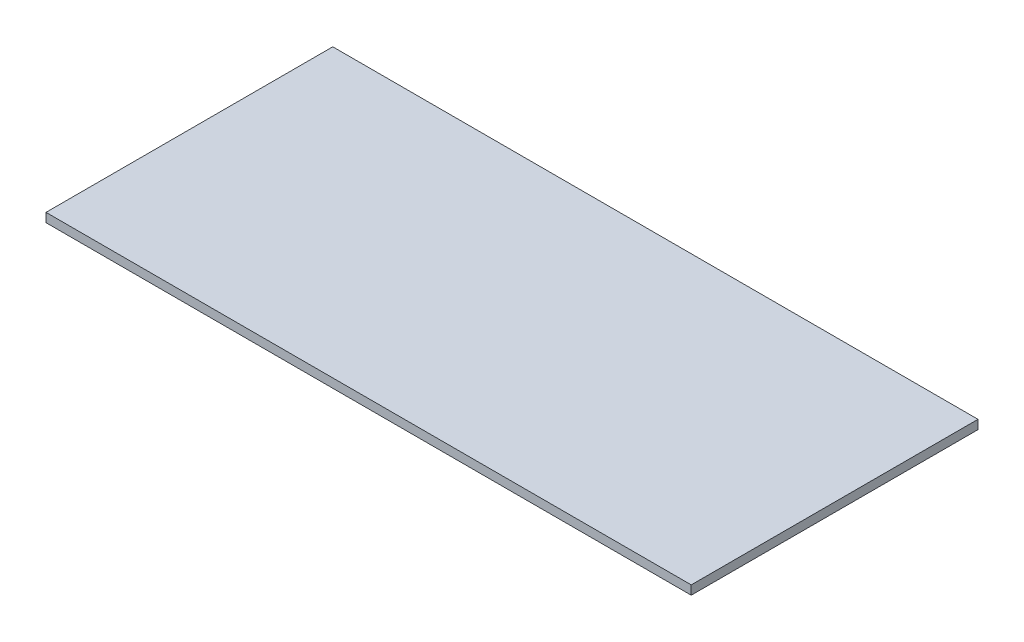
from build123d import *

# Parameters (mm, degrees)
SKETCH1_W           = 457.2
SKETCH1_H           = 203.2
BOSS_EXTRUDE1_DEPTH = 6.35


with BuildPart() as part:
    # Sketch1 → Boss-Extrude1 (new body)
    with BuildSketch(Plane(origin=(0, 0, 0), x_dir=(1, 0, 0), z_dir=(0, 1, 0))):
        Rectangle(SKETCH1_W, SKETCH1_H)
    extrude(amount=BOSS_EXTRUDE1_DEPTH)


solid = part.part
